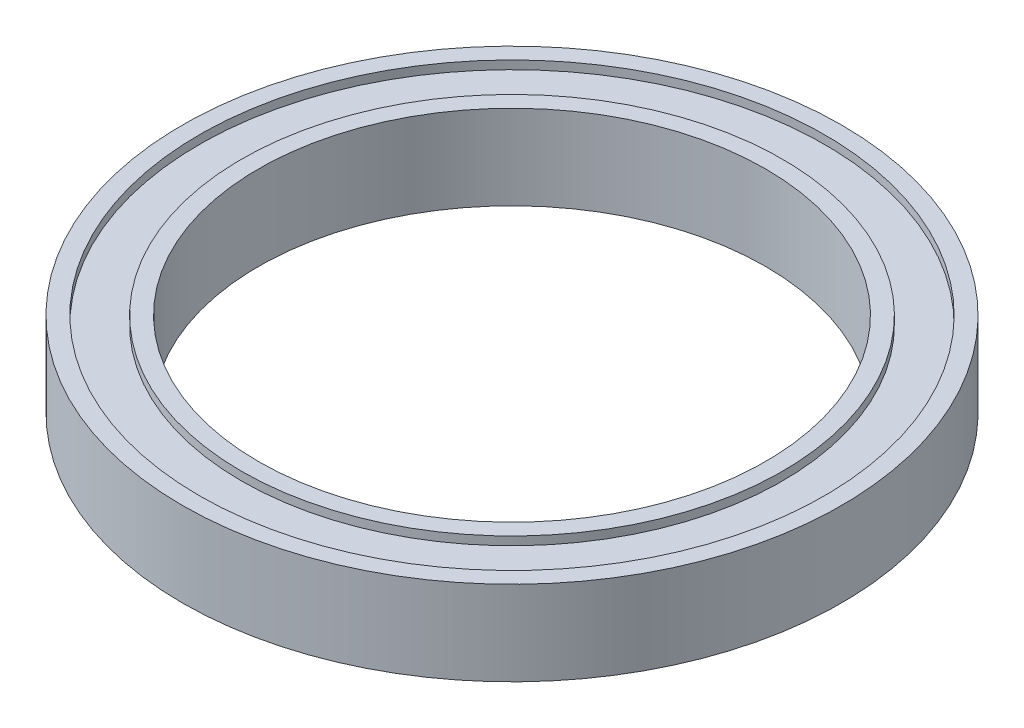
from build123d import *

# Parameters (mm, degrees)
SKETCH1_R           = 39
SKETCH1_R_2         = 30
BOSS_EXTRUDE1_DEPTH = 10
SKETCH2_R           = 37
SKETCH2_R_2         = 32
CUT_EXTRUDE1_DEPTH  = 1
CUT_EXTRUDE2_START  = -1
SKETCH3_R           = 37
SKETCH3_R_2         = 32
CUT_EXTRUDE2_DEPTH  = 1


with BuildPart() as part:
    # Sketch1 → Boss-Extrude1 (new body)
    with BuildSketch(Plane(origin=(0, 0, 0), x_dir=(1, 0, 0), z_dir=(0, 1, 0))):
        Circle(SKETCH1_R)
        Circle(SKETCH1_R_2, mode=Mode.SUBTRACT)
    extrude(amount=BOSS_EXTRUDE1_DEPTH)

    # Sketch2 → Cut-Extrude1 (cut)
    with BuildSketch(Plane(origin=(0, 10, 0), x_dir=(1, 0, 0), z_dir=(0, 1, 0))):
        Circle(SKETCH2_R)
        Circle(SKETCH2_R_2, mode=Mode.SUBTRACT)
    extrude(amount=-CUT_EXTRUDE1_DEPTH, mode=Mode.SUBTRACT)

    # Sketch3 → Cut-Extrude2 (cut)
    with BuildSketch(Plane.XZ.offset(CUT_EXTRUDE2_START)):
        Circle(SKETCH3_R)
        Circle(SKETCH3_R_2, mode=Mode.SUBTRACT)
    extrude(amount=CUT_EXTRUDE2_DEPTH, mode=Mode.SUBTRACT)


solid = part.part
